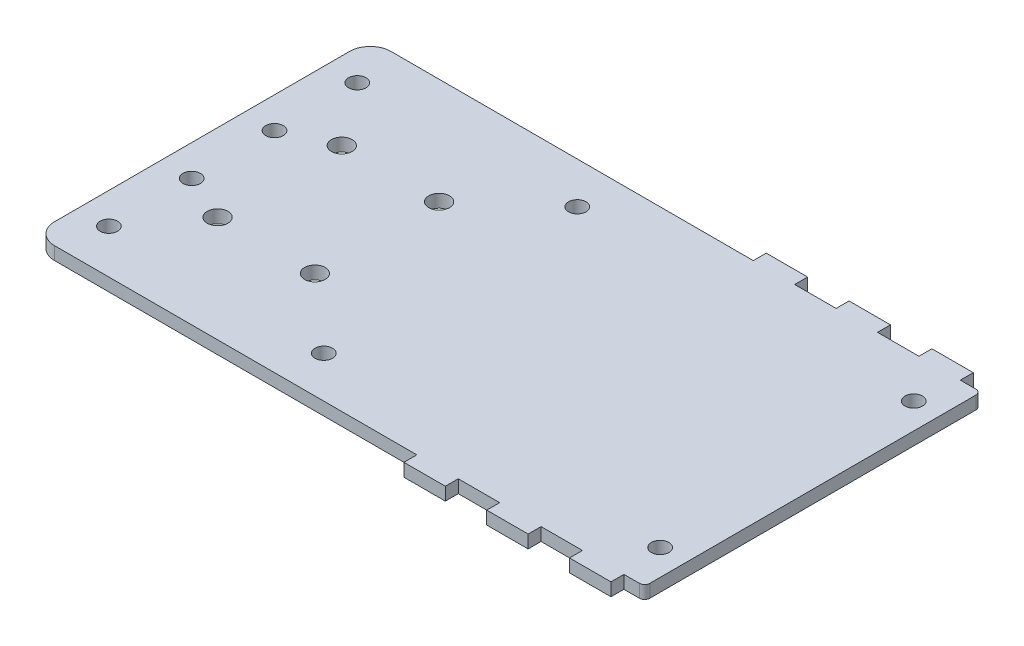
from build123d import *

# Parameters (mm, degrees)
MAIN_EXTRUDE_DEPTH            = 3.175
SKETCH2_R                     = 2.54
CASTER_MOUNTING_HOLES_DEPTH   = 89.274136218
SKETCH3_W                     = 2.54
SKETCH3_H                     = 82.55
REMOVE_UNEVEN_BACK_EDGE_DEPTH = 89.274136218
SKETCH5_R                     = 2.15
STANDOFF_HOLES_DEPTH          = 89.274136218
FILLET1_R                     = 5.08
FILLET2_R                     = 1.27
FILLET3_R                     = 1.27
SKETCH9_R                     = 2.15
FRONT_MOUNTING_HOLES_DEPTH    = 89.274136218


with BuildPart() as part:
    # Sketch1 → Main Extrude (new body)
    with BuildSketch(Plane(origin=(0, 0, 0), x_dir=(1, 0, 0), z_dir=(0, 1, 0))):
        Polygon((27.94, -41.275), (38.1, -41.275), (38.1, -44.45), (48.26, -44.45), (48.26, -41.275), (58.42, -41.275), (58.42, -44.45), (68.58, -44.45), (68.58, -41.275), (76.2, -41.275), (76.2, 41.275), (68.58, 41.275), (68.58, 44.45), (58.42, 44.45), (58.42, 41.275), (48.26, 41.275), (48.26, 44.45), (38.1, 44.45), (38.1, 41.275), (27.94, 41.275), (27.94, 44.45), (17.78, 44.45), (17.78, 41.275), (-76.2, 41.275), (-76.2, -41.275), (17.78, -41.275), (17.78, -44.45), (27.94, -44.45), align=None)
    extrude(amount=MAIN_EXTRUDE_DEPTH)

    # Sketch2 → Caster Mounting Holes (cut, through all)
    with BuildSketch(Plane(origin=(0, 3.175, 0), x_dir=(1, 0, 0), z_dir=(0, 1, 0))):
        with Locations((-57.15, 15.24)):
            Circle(SKETCH2_R)
        with Locations((-33.274, 15.24)):
            Circle(SKETCH2_R)
        with Locations((-33.274, -15.24)):
            Circle(SKETCH2_R)
        with Locations((-57.15, -15.24)):
            Circle(SKETCH2_R)
    extrude(amount=-CASTER_MOUNTING_HOLES_DEPTH, mode=Mode.SUBTRACT)

    # Sketch3 → Remove Uneven Back Edge (cut, through all)
    with BuildSketch(Plane(origin=(0, 3.175, 0), x_dir=(1, 0, 0), z_dir=(0, 1, 0))):
        with Locations((74.93, 0)):
            Rectangle(SKETCH3_W, SKETCH3_H)
    extrude(amount=-REMOVE_UNEVEN_BACK_EDGE_DEPTH, mode=Mode.SUBTRACT)

    # Sketch5 → Standoff Holes (cut, through all)
    with BuildSketch(Plane(origin=(0, 3.175, 0), x_dir=(1, 0, 0), z_dir=(0, 1, 0))):
        with Locations((-15.24, 31.115)):
            Circle(SKETCH5_R)
        with Locations((67.31, 31.115)):
            Circle(SKETCH5_R)
        with Locations((67.31, -31.115)):
            Circle(SKETCH5_R)
        with Locations((-15.24, -31.115)):
            Circle(SKETCH5_R)
    extrude(amount=-STANDOFF_HOLES_DEPTH, mode=Mode.SUBTRACT)

    # Fillet1
    fillet1_edges = [part.edges().sort_by_distance(p)[0] for p in [
        (-76.2, 1.5875, 41.275),
        (-76.2, 1.5875, -41.275),
    ]]
    fillet(fillet1_edges, radius=FILLET1_R)

    # Fillet2
    fillet2_edges = [part.edges().sort_by_distance(p)[0] for p in [
        (73.66, 1.5875, 41.275),
    ]]
    fillet(fillet2_edges, radius=FILLET2_R)

    # Fillet3
    fillet3_edges = [part.edges().sort_by_distance(p)[0] for p in [
        (73.66, 1.5875, -41.275),
    ]]
    fillet(fillet3_edges, radius=FILLET3_R)

    # Sketch9 → Front Mounting Holes (cut, through all)
    with BuildSketch(Plane(origin=(0, 3.175, 0), x_dir=(1, 0, 0), z_dir=(0, 1, 0))):
        with Locations((-68.58, -30.48)):
            Circle(SKETCH9_R)
        with Locations((-68.58, -10.16)):
            Circle(SKETCH9_R)
        with Locations((-68.58, 10.16)):
            Circle(SKETCH9_R)
        with Locations((-68.58, 30.48)):
            Circle(SKETCH9_R)
    extrude(amount=-FRONT_MOUNTING_HOLES_DEPTH, mode=Mode.SUBTRACT)


solid = part.part
